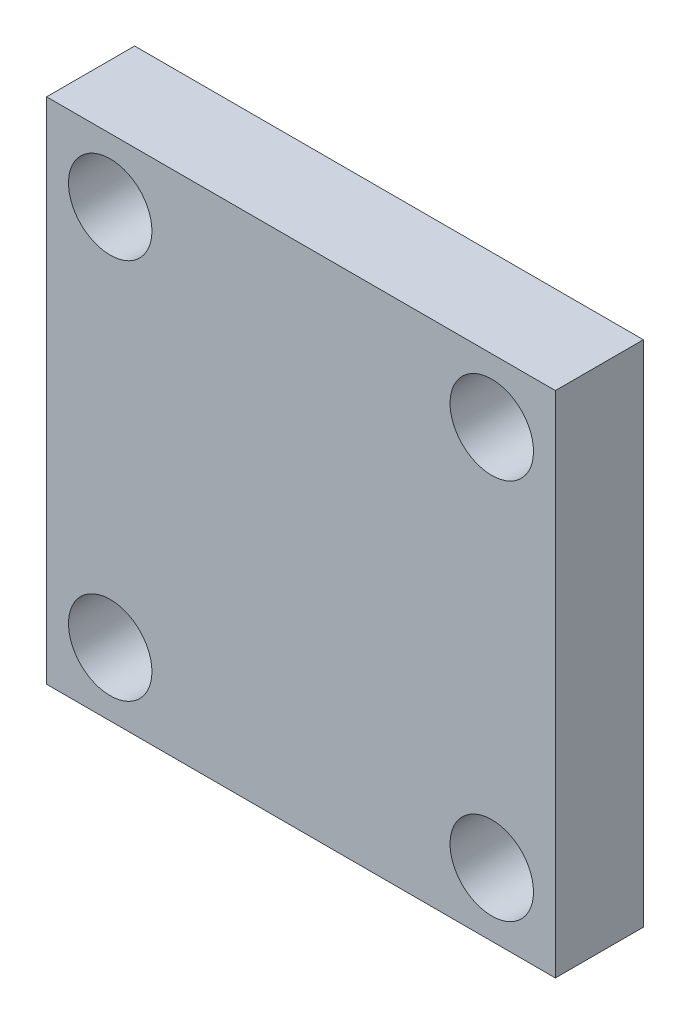
from build123d import *

# Parameters (mm, degrees)
SKETCH1_W           = 25.4
SKETCH1_H           = 25.4
SKETCH1_R           = 2.0828
BOSS_EXTRUDE1_DEPTH = 4.3942


with BuildPart() as part:
    # Sketch1 → Boss-Extrude1 (new body)
    with BuildSketch(Plane.XY):
        with Locations((12.7, 12.7)):
            Rectangle(SKETCH1_W, SKETCH1_H)
        with Locations((3.175, 3.175)):
            Circle(SKETCH1_R, mode=Mode.SUBTRACT)
        with Locations((3.175, 22.225)):
            Circle(SKETCH1_R, mode=Mode.SUBTRACT)
        with Locations((22.225, 22.225)):
            Circle(SKETCH1_R, mode=Mode.SUBTRACT)
        with Locations((22.225, 3.175)):
            Circle(SKETCH1_R, mode=Mode.SUBTRACT)
    extrude(amount=BOSS_EXTRUDE1_DEPTH)


solid = part.part
